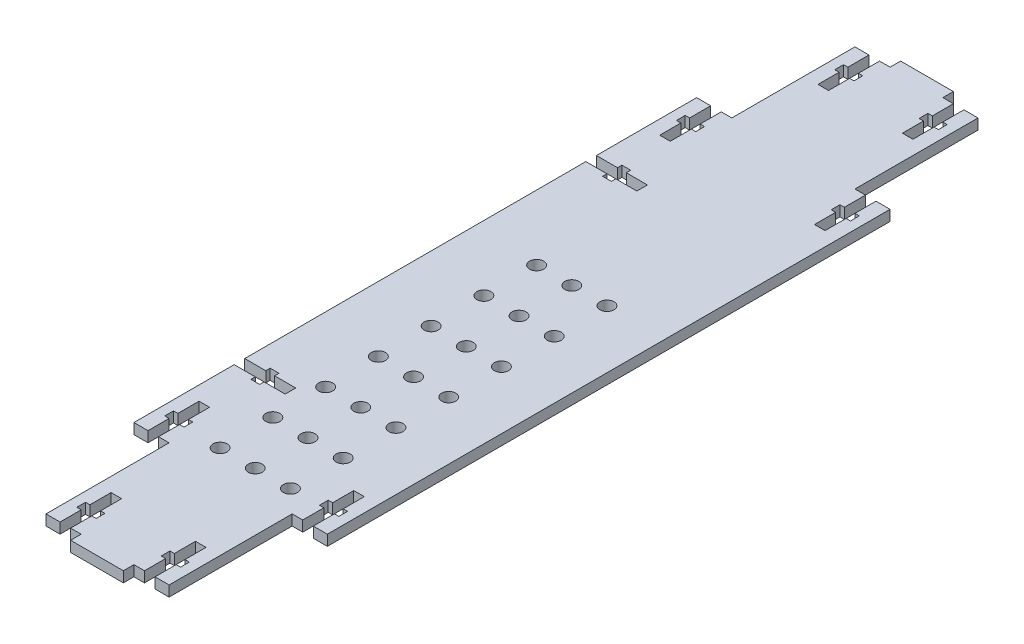
from build123d import *

# Parameters (mm, degrees)
SKETCH_1_W                  = 55
SKETCH_1_H                  = 160
EXTRUDE_1_DEPTH             = 3
EXTRUDE_2_DEPTH             = 35
EXTRUDE_2_DEPTH_BACK        = 195
SKETCH_2_W                  = 35
SKETCH_2_H                  = 3
EXTRUDE_3_DEPTH             = 3
EXTRUDE_3_DEPTH_BACK        = 233
SKETCH_3_W                  = 15
SKETCH_3_H                  = 3
CUT_EXTRUDE_1_DEPTH         = 3
CUT_EXTRUDE_2_DEPTH         = 3
SKETCH_6_R                  = 2
CUT_EXTRUDE_3_DEPTH         = 10
PATTERN_LINEAR_1_COUNT      = 7
PATTERN_LINEAR_1_PITCH      = 15
PATTERN_LINEAR_1_COUNT_DIR2 = 3
PATTERN_LINEAR_1_PITCH_DIR2 = 10


with BuildPart() as part:
    # Эскиз1 → Бобышка-Вытянуть1 (new body)
    with BuildSketch(Plane(origin=(0, 0, 0), x_dir=(1, 0, 0), z_dir=(0, 1, 0))):
        Rectangle(SKETCH_1_W, SKETCH_1_H)
    extrude(amount=EXTRUDE_1_DEPTH)

    # Эскиз2 → Бобышка-Вытянуть2 (add, two sides: drawn at the far end of the back side and taken through both)
    with BuildSketch(Plane(origin=(0, 0, -80), x_dir=(-1, 0, 0), z_dir=(0, 0, -1)).offset(-EXTRUDE_2_DEPTH_BACK)):
        with Locations((0, 1.5)):
            Rectangle(SKETCH_2_W, SKETCH_2_H)
    extrude(amount=EXTRUDE_2_DEPTH + EXTRUDE_2_DEPTH_BACK)

    # Эскиз3 → Бобышка-Вытянуть3 (add, two sides: drawn at the far end of the back side and taken through both)
    with BuildSketch(Plane(origin=(0, 0, -115), x_dir=(-1, 0, 0), z_dir=(0, 0, -1)).offset(-EXTRUDE_3_DEPTH_BACK)):
        with Locations((0, 1.5)):
            Rectangle(SKETCH_3_W, SKETCH_3_H)
    extrude(amount=EXTRUDE_3_DEPTH + EXTRUDE_3_DEPTH_BACK)

    # Эскиз4 → Вырез-Вытянуть1 (cut)
    with BuildSketch(Plane(origin=(0, 3, 0), x_dir=(1, 0, 0), z_dir=(0, 1, 0))):
        Polygon((-23.5, 80), (-23.5, 74), (-24.75, 74), (-24.75, 71.5), (-23.5, 71.5), (-23.5, 65.5), (-20.5, 65.5), (-20.5, 71.5), (-19.25, 71.5), (-19.25, 74), (-20.5, 74), (-20.5, 80), align=None)
        Polygon((-13.5, 115), (-13.5, 109), (-14.75, 109), (-14.75, 106.5), (-13.5, 106.5), (-13.5, 100.5), (-10.5, 100.5), (-10.5, 106.5), (-9.25, 106.5), (-9.25, 109), (-10.5, 109), (-10.5, 115), align=None)
        Polygon((10.5, 115), (13.5, 115), (13.5, 109), (14.75, 109), (14.75, 106.5), (13.5, 106.5), (13.5, 100.5), (10.5, 100.5), (10.5, 106.5), (9.25, 106.5), (9.25, 109), (10.5, 109), align=None)
        Polygon((20.5, 80), (23.5, 80), (23.5, 74), (24.75, 74), (24.75, 71.5), (23.5, 71.5), (23.5, 65.5), (20.5, 65.5), (20.5, 71.5), (19.25, 71.5), (19.25, 74), (20.5, 74), align=None)
        Polygon((-10.5, -115), (-13.5, -115), (-13.5, -109), (-14.75, -109), (-14.75, -106.5), (-13.5, -106.5), (-13.5, -100.5), (-10.5, -100.5), (-10.5, -106.5), (-9.25, -106.5), (-9.25, -109), (-10.5, -109), align=None)
        Polygon((13.5, -115), (13.5, -109), (14.75, -109), (14.75, -106.5), (13.5, -106.5), (13.5, -100.5), (10.5, -100.5), (10.5, -106.5), (9.25, -106.5), (9.25, -109), (10.5, -109), (10.5, -115), align=None)
        Polygon((-20.5, -80), (-23.5, -80), (-23.5, -74), (-24.75, -74), (-24.75, -71.5), (-23.5, -71.5), (-23.5, -65.5), (-20.5, -65.5), (-20.5, -71.5), (-19.25, -71.5), (-19.25, -74), (-20.5, -74), align=None)
        Polygon((23.5, -80), (23.5, -74), (24.75, -74), (24.75, -71.5), (23.5, -71.5), (23.5, -65.5), (20.5, -65.5), (20.5, -71.5), (19.25, -71.5), (19.25, -74), (20.5, -74), (20.5, -80), align=None)
    extrude(amount=-CUT_EXTRUDE_1_DEPTH, mode=Mode.SUBTRACT)

    # Эскиз5 → Вырез-Вытянуть2 (cut)
    with BuildSketch(Plane(origin=(0, 3, 0), x_dir=(1, 0, 0), z_dir=(0, 1, 0))):
        Polygon((-27.5, 51.5), (-21.5, 51.5), (-21.5, 52.75), (-19, 52.75), (-19, 51.5), (-13, 51.5), (-13, 48.5), (-19, 48.5), (-19, 47.25), (-21.5, 47.25), (-21.5, 48.5), (-27.5, 48.5), align=None)
        Polygon((-27.5, -48.5), (-27.5, -51.5), (-21.5, -51.5), (-21.5, -52.75), (-19, -52.75), (-19, -51.5), (-13, -51.5), (-13, -48.5), (-19, -48.5), (-19, -47.25), (-21.5, -47.25), (-21.5, -48.5), align=None)
    extrude(amount=-CUT_EXTRUDE_2_DEPTH, mode=Mode.SUBTRACT)

    # Эскиз6 → Вырез-Вытянуть3 (cut)
    with BuildSketch(Plane(origin=(0, 3, 0), x_dir=(1, 0, 0), z_dir=(0, 1, 0))):
        with Locations((-9, -74)):
            Circle(SKETCH_6_R)
    cut_extrude_3 = extrude(amount=-CUT_EXTRUDE_3_DEPTH, mode=Mode.SUBTRACT)

    # Линейный массив1: Cut-Extrude 3 7 × 3
    with Locations(*[(j * PATTERN_LINEAR_1_PITCH_DIR2, 0, -i * PATTERN_LINEAR_1_PITCH) for i in range(PATTERN_LINEAR_1_COUNT) for j in range(PATTERN_LINEAR_1_COUNT_DIR2) if (i, j) != (0, 0)]):
        add(cut_extrude_3, mode=Mode.SUBTRACT)


solid = part.part
